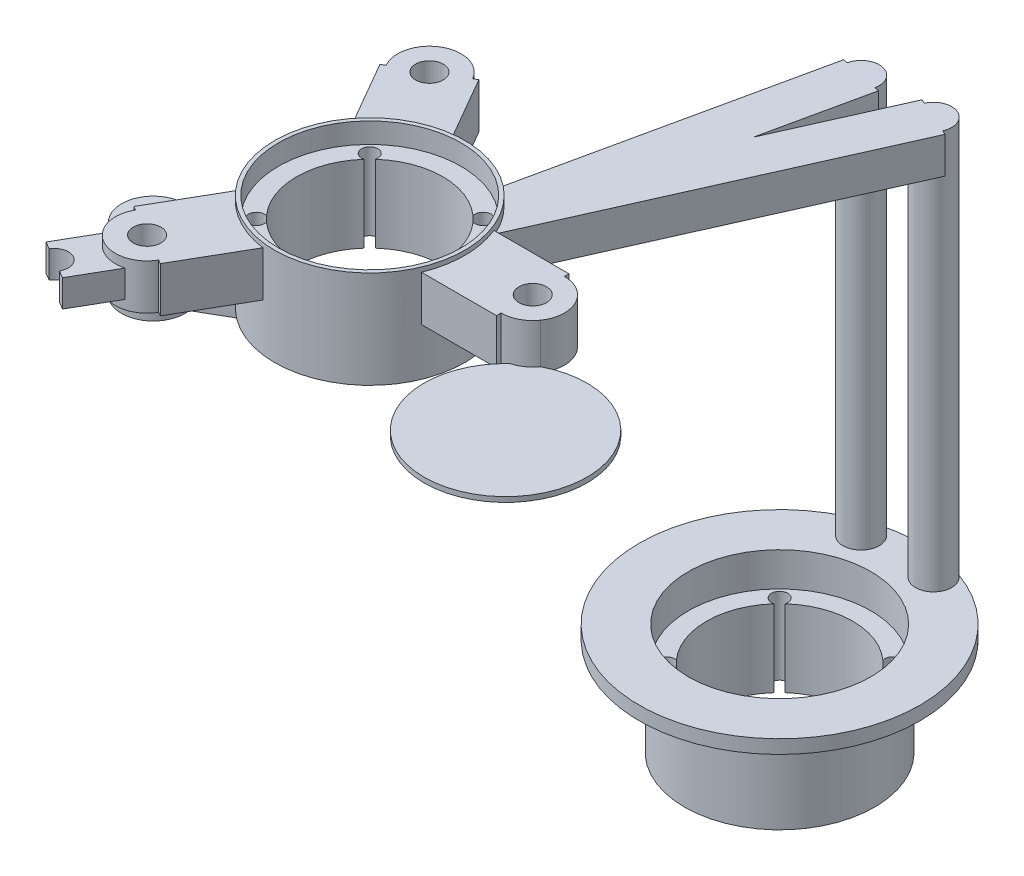
from build123d import *
from build123d.topology import SkipClean

# Parameters (mm, degrees)
CARRIER_GUIDE_FRAME_SKETCH_R   = 3.050000002
CARRIER_GUIDE_FRAME_SKETCH_R_2 = 3.050000001
CARRIER_GUIDE_FRAME_SKETCH_R_3 = 3.049999999
CARRIER_GUIDE_FRAME_DEPTH      = 4.5
CARRIER_START                  = -0.9
CARRIER_SECTION_2_SKETCH_R     = 3.050000002
CARRIER_SECTION_2_SKETCH_R_2   = 3.050000001
CARRIER_SECTION_2_SKETCH_R_3   = 3.049999999
CARRIER_SECTION_2_DEPTH        = 0.9
CARRIER_START_2                = -0.099999999
CARRIER_SECTION_3_SKETCH_R     = 3.050000002
CARRIER_SECTION_3_SKETCH_R_2   = 3.050000001
CARRIER_SECTION_3_SKETCH_R_3   = 3.049999999
CARRIER_SECTION_3_DEPTH        = 0.099999999
CARRIER_START_3                = -0.999999997
CARRIER_SECTION_4_SKETCH_R     = 4
CARRIER_SECTION_4_SKETCH_R_2   = 3.050000002
CARRIER_SECTION_4_SKETCH_R_3   = 3.050000001
CARRIER_SECTION_4_SKETCH_R_4   = 3.049999999
CARRIER_SECTION_4_DEPTH        = 0.999999997
CARRIER_START_4                = -0.010000004
CARRIER_SECTION_5_SKETCH_R     = 21
CARRIER_SECTION_5_SKETCH_R_2   = 18.000000001
CARRIER_SECTION_5_SKETCH_R_3   = 4
CARRIER_SECTION_5_DEPTH        = 0.010000004
CARRIER_START_5                = -0.490000001
CARRIER_SECTION_6_SKETCH_R     = 21
CARRIER_SECTION_6_SKETCH_R_2   = 4
CARRIER_SECTION_6_DEPTH        = 0.490000001
CARRIER_START_6                = -2.999999998
CARRIER_SECTION_7_SKETCH_R     = 21
CARRIER_SECTION_7_SKETCH_R_2   = 4
CARRIER_SECTION_7_SKETCH_R_3   = 3.1
CARRIER_SECTION_7_DEPTH        = 2.999999998
CARRIER_SECTION_8_SKETCH_R     = 21
CARRIER_SECTION_8_SKETCH_R_2   = 4
CARRIER_SECTION_8_DEPTH        = 2.500000001
CARRIER_SECTION_9_SKETCH_R     = 4
CARRIER_SECTION_9_DEPTH        = 4.5
CARRIER_SECTION_10_SKETCH_R    = 4
CARRIER_SECTION_10_DEPTH       = 1.000000001
CARRIER_SECTION_11_SKETCH_R    = 4
CARRIER_SECTION_11_SKETCH_R_2  = 3.1
CARRIER_SECTION_11_DEPTH       = 0.5
CARRIER_SECTION_12_SKETCH_R    = 4
CARRIER_SECTION_12_SKETCH_R_2  = 3.1
CARRIER_SECTION_12_DEPTH       = 2.499999999
CARRIER_SECTION_13_SKETCH_R    = 4
CARRIER_SECTION_13_DEPTH       = 64.500000004
CARRIER_SECTION_14_SKETCH_R    = 20.15
CARRIER_SECTION_14_DEPTH       = 2.999999999
CARRIER_SECTION_15_SKETCH_R    = 21
CARRIER_SECTION_15_SKETCH_R_2  = 20.15
CARRIER_SECTION_15_DEPTH       = 4.499999998
CARRIER_SECTION_16_SKETCH_R    = 21
CARRIER_SECTION_16_DEPTH       = 17
CARRIER_SECTION_17_SKETCH_R    = 3.050000003
CARRIER_SECTION_17_SKETCH_R_2  = 20.150000001
CARRIER_SECTION_17_SKETCH_R_3  = 3.05
CARRIER_SECTION_17_DEPTH       = 1.499999999
CARRIER_SECTION_18_SKETCH_R    = 3.050000003
CARRIER_SECTION_18_SKETCH_R_2  = 20.150000001
CARRIER_SECTION_18_SKETCH_R_3  = 3.05
CARRIER_SECTION_18_DEPTH       = 0.999999998
CARRIER_SECTION_19_SKETCH_R    = 3.050000003
CARRIER_SECTION_19_SKETCH_R_2  = 20.150000001
CARRIER_SECTION_19_SKETCH_R_3  = 3.05
CARRIER_SECTION_19_DEPTH       = 1.000000007
CARRIER_START_7                = -123.999999996
CARRIER_SECTION_20_OUTLINE_R   = 21
CARRIER_SECTION_20_OUTLINE_R_2 = 20.150000001
CARRIER_SECTION_20_DEPTH       = 0.999999996


with BuildPart() as part:
    # Carrier Guide Frame Sketch → Carrier Guide Frame (new body)
    with BuildSketch(Plane(origin=(0, -132, 0), x_dir=(1, 0, 0), z_dir=(0, 1, 0))):
        with BuildLine():
            Line((-67.363448016, 35.176914536), (-59.071691935, 20.815171721))
            ThreePointArc((-59.071691935, 20.815171721), (-52.021603007, 20.561291011), (-45.453402185, 17.987005234))
            Line((-45.453402185, 17.987005234), (-31.894893673, 80.307817537))
            Line((-31.894893673, 80.307817537), (-30.917751514, 80.095230605))
            ThreePointArc((-30.917751514, 80.095230605), (-29.450257235, 82.413661193), (-26.834136801, 83.241050902))
            ThreePointArc((-26.834136801, 83.241050902), (-23.840404569, 81.68595723), (-23.100614252, 78.394535152))
            Line((-23.100614252, 78.394535152), (-22.123472094, 78.181948221))
            Line((-22.123472094, 78.181948221), (-27.059261592, 55.49490926))
            Line((-27.059261592, 55.49490926), (-15.576730603, 81.278969365))
            Line((-15.576730603, 81.278969365), (-14.663221052, 80.872152065))
            ThreePointArc((-14.663221052, 80.872152065), (-12.020207409, 83.115002953), (-8.617920583, 82.451417558))
            ThreePointArc((-8.617920583, 82.451417558), (-7.1390628, 80.255907409), (-7.355144702, 77.617613686))
            Line((-7.355144702, 77.617613686), (-6.441635165, 77.210796392))
            Line((-6.441635165, 77.210796392), (-37.06497245, 8.445994462))
            ThreePointArc((-37.06497245, 8.445994462), (-36.968781126, 8.223544876), (-36.875163407, 8))
            Line((-36.875163407, 8), (-20.291651247, 8))
            Line((-20.291651247, 8), (-20.291651247, 7))
            ThreePointArc((-20.291651247, 7), (-14.084717769, 3.236352392), (-14.552272959, -4.007435199))
            Line((-14.552272959, -4.007435199), (-14.566573894, -4.027839286))
            ThreePointArc((-14.566573894, -4.027839286), (-17.066350873, -6.212683599), (-20.291651246, -7))
            Line((-20.291651246, -7), (-20.291651246, -8))
            Line((-20.291651246, -8), (-36.875163407, -8))
            ThreePointArc((-36.875163407, -8), (-44.6083298, -17.449928367), (-56.291651246, -21))
            ThreePointArc((-56.291651246, -21), (-57.684740236, -20.953741982), (-59.071691937, -20.815171721))
            Line((-59.071691937, -20.815171721), (-67.363448017, -35.176914536))
            Line((-67.363448017, -35.176914536), (-68.229473419, -34.676914537))
            ThreePointArc((-68.229473419, -34.676914537), (-70.002040821, -36.708572734), (-72.411013969, -37.919555224))
            Line((-72.411013969, -37.919555224), (-77.461524226, -46.667295594))
            Line((-77.461524226, -46.667295594), (-79.106972494, -45.717295594))
            ThreePointArc((-79.106972494, -45.717295594), (-80.241651245, -41.482616842), (-84.476329997, -42.617295594))
            Line((-84.476329997, -42.617295594), (-86.121778264, -41.667295594))
            Line((-86.121778264, -41.667295594), (-81.071268007, -32.919555224))
            ThreePointArc((-81.071268007, -32.919555224), (-81.227012981, -30.227832035), (-80.353829072, -27.676914537))
            Line((-80.353829072, -27.676914537), (-81.219854478, -27.176914536))
            Line((-81.219854478, -27.176914536), (-72.928098397, -12.815171719))
            ThreePointArc((-72.928098397, -12.815171719), (-77.291651246, 0), (-72.928098397, 12.815171719))
            Line((-72.928098397, 12.815171719), (-81.219854478, 27.176914536))
            Line((-81.219854478, 27.176914536), (-80.353829074, 27.676914536))
            ThreePointArc((-80.353829074, 27.676914536), (-77.791651248, 37.239092362), (-68.229473421, 34.676914535))
            Line((-68.229473421, 34.676914535), (-67.363448016, 35.176914536))
        make_face()
        with Locations(Location((-74.291651248, 31.176914536, 0), (0, 0, 270))):
            Circle(CARRIER_GUIDE_FRAME_SKETCH_R, mode=Mode.SUBTRACT)
        with Locations(Location((-20.291651247, 0, 0), (0, 0, 270))):
            Circle(CARRIER_GUIDE_FRAME_SKETCH_R_2, mode=Mode.SUBTRACT)
        with Locations(Location((-74.291651245, -31.176914537, 0), (0, 0, 270))):
            Circle(CARRIER_GUIDE_FRAME_SKETCH_R_3, mode=Mode.SUBTRACT)
        with BuildLine():
            ThreePointArc((-68.31259652, -10.785146023), (-70.080233479, -13.788582233), (-67.076797269, -12.020945274))
            ThreePointArc((-67.076797269, -12.020945274), (-56.291651246, -16.15), (-45.506505223, -12.020945274))
            ThreePointArc((-45.506505223, -12.020945274), (-42.503069013, -13.788582233), (-44.270705972, -10.785146023))
            ThreePointArc((-44.270705972, -10.785146023), (-40.141651246, 0), (-44.270705972, 10.785146023))
            ThreePointArc((-44.270705972, 10.785146023), (-42.503069013, 13.788582233), (-45.506505223, 12.020945274))
            ThreePointArc((-45.506505223, 12.020945274), (-56.291651246, 16.15), (-67.076797269, 12.020945274))
            ThreePointArc((-67.076797269, 12.020945274), (-70.080233479, 13.788582233), (-68.31259652, 10.785146023))
            ThreePointArc((-68.31259652, 10.785146023), (-72.441651246, 0), (-68.31259652, -10.785146023))
        make_face(mode=Mode.SUBTRACT)
    extrude(amount=CARRIER_GUIDE_FRAME_DEPTH)

    # Carrier Section 2 Sketch → Carrier Section 2 (add)
    with BuildSketch(Plane(origin=(0, -132, 0), x_dir=(1, 0, 0), z_dir=(0, 1, 0)).offset(CARRIER_START)):
        with BuildLine():
            Line((-67.363448016, 35.176914536), (-59.071691936, 20.815171721))
            ThreePointArc((-59.071691936, 20.815171721), (-52.021603008, 20.561291011), (-45.453402185, 17.987005234))
            Line((-45.453402185, 17.987005234), (-31.894893673, 80.307817537))
            Line((-31.894893673, 80.307817537), (-30.917751514, 80.095230605))
            ThreePointArc((-30.917751514, 80.095230605), (-29.450257235, 82.413661193), (-26.834136801, 83.241050902))
            ThreePointArc((-26.834136801, 83.241050902), (-23.840404569, 81.68595723), (-23.100614253, 78.394535152))
            Line((-23.100614253, 78.394535152), (-22.123472094, 78.181948221))
            Line((-22.123472094, 78.181948221), (-27.059261592, 55.49490926))
            Line((-27.059261592, 55.49490926), (-15.576730603, 81.278969365))
            Line((-15.576730603, 81.278969365), (-14.663221052, 80.872152065))
            ThreePointArc((-14.663221052, 80.872152065), (-12.020207409, 83.115002953), (-8.617920583, 82.451417558))
            ThreePointArc((-8.617920583, 82.451417558), (-7.1390628, 80.255907409), (-7.355144702, 77.617613686))
            Line((-7.355144702, 77.617613686), (-6.441635165, 77.210796392))
            Line((-6.441635165, 77.210796392), (-37.06497245, 8.445994462))
            ThreePointArc((-37.06497245, 8.445994462), (-36.968781126, 8.223544876), (-36.875163407, 8))
            Line((-36.875163407, 8), (-20.291651247, 8))
            Line((-20.291651247, 8), (-20.291651247, 7))
            ThreePointArc((-20.291651247, 7), (-14.084717769, 3.236352392), (-14.55227296, -4.007435199))
            Line((-14.55227296, -4.007435199), (-14.566573895, -4.027839286))
            ThreePointArc((-14.566573895, -4.027839286), (-17.066350873, -6.212683599), (-20.291651246, -7))
            Line((-20.291651246, -7), (-20.291651246, -8))
            Line((-20.291651246, -8), (-36.875163407, -8))
            ThreePointArc((-36.875163407, -8), (-44.6083298, -17.449928367), (-56.291651246, -21))
            ThreePointArc((-56.291651246, -21), (-57.684740236, -20.953741982), (-59.071691937, -20.815171721))
            Line((-59.071691937, -20.815171721), (-67.363448017, -35.176914536))
            Line((-67.363448017, -35.176914536), (-68.229473419, -34.676914537))
            ThreePointArc((-68.229473419, -34.676914537), (-70.002040821, -36.708572734), (-72.411013969, -37.919555224))
            ThreePointArc((-72.411013969, -37.919555224), (-79.823309442, -35.466524962), (-80.353829071, -27.676914537))
            Line((-80.353829071, -27.676914537), (-81.219854478, -27.176914536))
            Line((-81.219854478, -27.176914536), (-72.928098397, -12.815171719))
            ThreePointArc((-72.928098397, -12.815171719), (-77.291651246, 0), (-72.928098397, 12.815171719))
            Line((-72.928098397, 12.815171719), (-81.219854478, 27.176914536))
            Line((-81.219854478, 27.176914536), (-80.353829074, 27.676914536))
            ThreePointArc((-80.353829074, 27.676914536), (-77.791651248, 37.239092362), (-68.229473421, 34.676914535))
            Line((-68.229473421, 34.676914535), (-67.363448016, 35.176914536))
        make_face()
        with Locations(Location((-74.291651248, 31.176914536, 0), (0, 0, 269.999999999))):
            Circle(CARRIER_SECTION_2_SKETCH_R, mode=Mode.SUBTRACT)
        with Locations(Location((-20.291651247, 0, 0), (0, 0, 270.000000005))):
            Circle(CARRIER_SECTION_2_SKETCH_R_2, mode=Mode.SUBTRACT)
        with Locations(Location((-74.291651245, -31.176914537, 0), (0, 0, 270.000000001))):
            Circle(CARRIER_SECTION_2_SKETCH_R_3, mode=Mode.SUBTRACT)
        with BuildLine():
            ThreePointArc((-68.31259652, -10.785146023), (-70.080233479, -13.788582233), (-67.076797269, -12.020945274))
            ThreePointArc((-67.076797269, -12.020945274), (-56.291651246, -16.15), (-45.506505223, -12.020945274))
            ThreePointArc((-45.506505223, -12.020945274), (-42.503069013, -13.788582233), (-44.270705972, -10.785146023))
            ThreePointArc((-44.270705972, -10.785146023), (-40.141651246, 0), (-44.270705972, 10.785146023))
            ThreePointArc((-44.270705972, 10.785146023), (-42.503069013, 13.788582233), (-45.506505223, 12.020945274))
            ThreePointArc((-45.506505223, 12.020945274), (-56.291651246, 16.15), (-67.076797269, 12.020945274))
            ThreePointArc((-67.076797269, 12.020945274), (-70.080233479, 13.788582233), (-68.31259652, 10.785146023))
            ThreePointArc((-68.31259652, 10.785146023), (-72.441651246, 0), (-68.31259652, -10.785146023))
        make_face(mode=Mode.SUBTRACT)
    extrude(amount=CARRIER_SECTION_2_DEPTH)

    # Carrier Section 3 Sketch → Carrier Section 3 (add)
    with BuildSketch(Plane(origin=(0, -132.900000001, 0), x_dir=(1, 0, 0), z_dir=(0, 1, 0)).offset(CARRIER_START_2)):
        with BuildLine():
            Line((-67.363448016, 35.176914536), (-59.071691936, 20.815171721))
            ThreePointArc((-59.071691936, 20.815171721), (-52.021603008, 20.561291011), (-45.453402185, 17.987005234))
            Line((-45.453402185, 17.987005234), (-31.894893673, 80.307817537))
            Line((-31.894893673, 80.307817537), (-30.917751514, 80.095230605))
            ThreePointArc((-30.917751514, 80.095230605), (-29.450257235, 82.413661193), (-26.834136801, 83.241050902))
            ThreePointArc((-26.834136801, 83.241050902), (-23.840404569, 81.68595723), (-23.100614253, 78.394535152))
            Line((-23.100614253, 78.394535152), (-22.123472094, 78.181948221))
            Line((-22.123472094, 78.181948221), (-27.059261593, 55.49490926))
            Line((-27.059261593, 55.49490926), (-15.576730603, 81.278969365))
            Line((-15.576730603, 81.278969365), (-14.663221052, 80.872152065))
            ThreePointArc((-14.663221052, 80.872152065), (-12.020207409, 83.115002953), (-8.617920583, 82.451417558))
            ThreePointArc((-8.617920583, 82.451417558), (-7.1390628, 80.255907409), (-7.355144702, 77.617613686))
            Line((-7.355144702, 77.617613686), (-6.441635165, 77.210796392))
            Line((-6.441635165, 77.210796392), (-37.06497245, 8.445994462))
            ThreePointArc((-37.06497245, 8.445994462), (-36.968781126, 8.223544876), (-36.875163407, 8))
            Line((-36.875163407, 8), (-20.291651247, 8))
            Line((-20.291651247, 8), (-20.291651247, 7))
            ThreePointArc((-20.291651247, 7), (-14.084717769, 3.236352392), (-14.55227296, -4.007435199))
            ThreePointArc((-14.55227296, -4.007435199), (4.030670954, -34.74617457), (-18.490761077, -6.764376882))
            ThreePointArc((-18.490761077, -6.764376882), (-19.383531808, -6.940844263), (-20.291651246, -7))
            Line((-20.291651246, -7), (-20.291651246, -8))
            Line((-20.291651246, -8), (-36.875163407, -8))
            ThreePointArc((-36.875163407, -8), (-44.6083298, -17.449928367), (-56.291651246, -21))
            ThreePointArc((-56.291651246, -21), (-57.684740236, -20.953741982), (-59.071691937, -20.815171721))
            Line((-59.071691937, -20.815171721), (-67.363448017, -35.176914536))
            Line((-67.363448017, -35.176914536), (-68.229473419, -34.676914537))
            ThreePointArc((-68.229473419, -34.676914537), (-70.002040821, -36.708572734), (-72.411013969, -37.919555224))
            ThreePointArc((-72.411013969, -37.919555224), (-79.823309442, -35.466524962), (-80.353829071, -27.676914537))
            Line((-80.353829071, -27.676914537), (-81.219854478, -27.176914536))
            Line((-81.219854478, -27.176914536), (-72.928098397, -12.815171719))
            ThreePointArc((-72.928098397, -12.815171719), (-77.291651246, 0), (-72.928098397, 12.815171719))
            Line((-72.928098397, 12.815171719), (-81.219854478, 27.176914536))
            Line((-81.219854478, 27.176914536), (-80.353829074, 27.676914536))
            ThreePointArc((-80.353829074, 27.676914536), (-77.791651248, 37.239092362), (-68.229473421, 34.676914535))
            Line((-68.229473421, 34.676914535), (-67.363448016, 35.176914536))
        make_face()
        with Locations(Location((-74.291651248, 31.176914536, 0), (0, 0, 269.999999999))):
            Circle(CARRIER_SECTION_3_SKETCH_R, mode=Mode.SUBTRACT)
        with Locations(Location((-20.291651247, 0, 0), (0, 0, 270.000000006))):
            Circle(CARRIER_SECTION_3_SKETCH_R_2, mode=Mode.SUBTRACT)
        with Locations(Location((-74.291651245, -31.176914537, 0), (0, 0, 270.000000001))):
            Circle(CARRIER_SECTION_3_SKETCH_R_3, mode=Mode.SUBTRACT)
        with BuildLine():
            ThreePointArc((-68.31259652, -10.785146023), (-70.080233479, -13.788582233), (-67.076797269, -12.020945274))
            ThreePointArc((-67.076797269, -12.020945274), (-56.291651246, -16.15), (-45.506505223, -12.020945274))
            ThreePointArc((-45.506505223, -12.020945274), (-42.503069013, -13.788582233), (-44.270705972, -10.785146023))
            ThreePointArc((-44.270705972, -10.785146023), (-40.141651246, 0), (-44.270705972, 10.785146023))
            ThreePointArc((-44.270705972, 10.785146023), (-42.503069013, 13.788582233), (-45.506505223, 12.020945274))
            ThreePointArc((-45.506505223, 12.020945274), (-56.291651246, 16.15), (-67.076797269, 12.020945274))
            ThreePointArc((-67.076797269, 12.020945274), (-70.080233479, 13.788582233), (-68.31259652, 10.785146023))
            ThreePointArc((-68.31259652, 10.785146023), (-72.441651246, 0), (-68.31259652, -10.785146023))
        make_face(mode=Mode.SUBTRACT)
    extrude(amount=CARRIER_SECTION_3_DEPTH)

    # Carrier Section 4 Sketch → Carrier Section 4 (add)
    # profile 1 of 3: a face of its own
    with BuildSketch(Plane(origin=(0, -133, 0), x_dir=(1, 0, 0), z_dir=(0, 1, 0)).offset(CARRIER_START_3)):
        with Locations(Location((-27.009182884, 79.244882879, 0), (0, 0, 167.726003725))):
            Circle(CARRIER_SECTION_4_SKETCH_R)
    # profile 2 of 3: a face of its own
    with BuildSketch(Plane(origin=(0, -133, 0), x_dir=(1, 0, 0), z_dir=(0, 1, 0)).offset(CARRIER_START_3)):
        with Locations(Location((-11.009182876, 79.244882879, 0), (0, 0, 155.994941476))):
            Circle(CARRIER_SECTION_4_SKETCH_R)
    # profile 3 of 3: a face of its own
    with BuildSketch(Plane(origin=(0, -133, 0), x_dir=(1, 0, 0), z_dir=(0, 1, 0)).offset(CARRIER_START_3)):
        with BuildLine():
            Line((-67.363448016, 35.176914536), (-59.071691936, 20.815171721))
            ThreePointArc((-59.071691936, 20.815171721), (-45.791651246, 18.18653348), (-36.875163407, 8))
            Line((-36.875163407, 8), (-20.291651247, 8))
            Line((-20.291651247, 8), (-20.291651247, 7))
            ThreePointArc((-20.291651247, 7), (-14.084717769, 3.236352392), (-14.55227296, -4.007435199))
            ThreePointArc((-14.55227296, -4.007435199), (4.030670954, -34.74617457), (-18.490761077, -6.764376882))
            ThreePointArc((-18.490761077, -6.764376882), (-19.383531808, -6.940844263), (-20.291651246, -7))
            Line((-20.291651246, -7), (-20.291651246, -8))
            Line((-20.291651246, -8), (-36.875163407, -8))
            ThreePointArc((-36.875163407, -8), (-44.6083298, -17.449928367), (-56.291651246, -21))
            ThreePointArc((-56.291651246, -21), (-57.684740236, -20.953741982), (-59.071691937, -20.815171721))
            Line((-59.071691937, -20.815171721), (-67.363448017, -35.176914536))
            Line((-67.363448017, -35.176914536), (-68.229473419, -34.676914537))
            ThreePointArc((-68.229473419, -34.676914537), (-70.002040821, -36.708572734), (-72.411013969, -37.919555224))
            ThreePointArc((-72.411013969, -37.919555224), (-79.823309442, -35.466524962), (-80.353829071, -27.676914537))
            Line((-80.353829071, -27.676914537), (-81.219854478, -27.176914536))
            Line((-81.219854478, -27.176914536), (-72.928098397, -12.815171719))
            ThreePointArc((-72.928098397, -12.815171719), (-77.291651246, 0), (-72.928098397, 12.815171719))
            Line((-72.928098397, 12.815171719), (-81.219854478, 27.176914536))
            Line((-81.219854478, 27.176914536), (-80.353829074, 27.676914536))
            ThreePointArc((-80.353829074, 27.676914536), (-77.791651248, 37.239092362), (-68.229473421, 34.676914535))
            Line((-68.229473421, 34.676914535), (-67.363448016, 35.176914536))
        make_face()
        with Locations(Location((-74.291651248, 31.176914536, 0), (0, 0, 269.999999999))):
            Circle(CARRIER_SECTION_4_SKETCH_R_2, mode=Mode.SUBTRACT)
        with Locations(Location((-20.291651247, 0, 0), (0, 0, 270.000000006))):
            Circle(CARRIER_SECTION_4_SKETCH_R_3, mode=Mode.SUBTRACT)
        with Locations(Location((-74.291651245, -31.176914537, 0), (0, 0, 270.000000001))):
            Circle(CARRIER_SECTION_4_SKETCH_R_4, mode=Mode.SUBTRACT)
        with BuildLine():
            ThreePointArc((-68.31259652, -10.785146023), (-70.080233479, -13.788582233), (-67.076797269, -12.020945274))
            ThreePointArc((-67.076797269, -12.020945274), (-56.291651246, -16.15), (-45.506505223, -12.020945274))
            ThreePointArc((-45.506505223, -12.020945274), (-42.503069013, -13.788582233), (-44.270705972, -10.785146023))
            ThreePointArc((-44.270705972, -10.785146023), (-40.141651246, 0), (-44.270705972, 10.785146023))
            ThreePointArc((-44.270705972, 10.785146023), (-42.503069013, 13.788582233), (-45.506505223, 12.020945274))
            ThreePointArc((-45.506505223, 12.020945274), (-56.291651246, 16.15), (-67.076797269, 12.020945274))
            ThreePointArc((-67.076797269, 12.020945274), (-70.080233479, 13.788582233), (-68.31259652, 10.785146023))
            ThreePointArc((-68.31259652, 10.785146023), (-72.441651246, 0), (-68.31259652, -10.785146023))
        make_face(mode=Mode.SUBTRACT)
    extrude(amount=CARRIER_SECTION_4_DEPTH)

    # Carrier Section 5 Sketch → Carrier Section 5 (add)
    # profile 1 of 4: a face of its own
    with SkipClean():  # the faces are left unmerged after this step: merging them gives an invalid solid
        with BuildSketch(Plane(origin=(0, -133.999999997, 0), x_dir=(1, 0, 0), z_dir=(0, 1, 0)).offset(CARRIER_START_4)):
            with Locations(Location((-56.291651246, 0, 0), (0, 0, 97.607312195))):
                Circle(CARRIER_SECTION_5_SKETCH_R)
            with BuildLine():
                ThreePointArc((-68.31259652, -10.785146023), (-70.080233479, -13.788582233), (-67.076797269, -12.020945274))
                ThreePointArc((-67.076797269, -12.020945274), (-56.291651246, -16.15), (-45.506505223, -12.020945274))
                ThreePointArc((-45.506505223, -12.020945274), (-42.503069013, -13.788582233), (-44.270705972, -10.785146023))
                ThreePointArc((-44.270705972, -10.785146023), (-40.141651246, 0), (-44.270705972, 10.785146023))
                ThreePointArc((-44.270705972, 10.785146023), (-42.503069013, 13.788582233), (-45.506505223, 12.020945274))
                ThreePointArc((-45.506505223, 12.020945274), (-56.291651246, 16.15), (-67.076797269, 12.020945274))
                ThreePointArc((-67.076797269, 12.020945274), (-70.080233479, 13.788582233), (-68.31259652, 10.785146023))
                ThreePointArc((-68.31259652, 10.785146023), (-72.441651246, 0), (-68.31259652, -10.785146023))
            make_face(mode=Mode.SUBTRACT)
        # profile 2 of 4: a face of its own
        with BuildSketch(Plane(origin=(0, -133.999999997, 0), x_dir=(1, 0, 0), z_dir=(0, 1, 0)).offset(CARRIER_START_4)):
            with Locations(Location((-6.291651246, -20, 0), (0, 0, 270))):
                Circle(CARRIER_SECTION_5_SKETCH_R_2)
        # profile 3 of 4: a face of its own
        with BuildSketch(Plane(origin=(0, -133.999999997, 0), x_dir=(1, 0, 0), z_dir=(0, 1, 0)).offset(CARRIER_START_4)):
            with Locations(Location((-27.009182884, 79.244882879, 0), (0, 0, 167.726003725))):
                Circle(CARRIER_SECTION_5_SKETCH_R_3)
        # profile 4 of 4: a face of its own
        with BuildSketch(Plane(origin=(0, -133.999999997, 0), x_dir=(1, 0, 0), z_dir=(0, 1, 0)).offset(CARRIER_START_4)):
            with Locations(Location((-11.009182876, 79.244882879, 0), (0, 0, 155.994941476))):
                Circle(CARRIER_SECTION_5_SKETCH_R_3)
        extrude(amount=CARRIER_SECTION_5_DEPTH)

    # Carrier Section 6 Sketch → Carrier Section 6 (add)
    # profile 1 of 3: a face of its own
    with SkipClean():  # the faces are left unmerged after this step: merging them gives an invalid solid
        with BuildSketch(Plane(origin=(0, -134.010000001, 0), x_dir=(1, 0, 0), z_dir=(0, 1, 0)).offset(CARRIER_START_5)):
            with Locations(Location((-56.291651246, 0, 0), (0, 0, 97.607312195))):
                Circle(CARRIER_SECTION_6_SKETCH_R)
            with BuildLine():
                ThreePointArc((-68.31259652, -10.785146023), (-70.080233479, -13.788582233), (-67.076797269, -12.020945274))
                ThreePointArc((-67.076797269, -12.020945274), (-56.291651246, -16.15), (-45.506505223, -12.020945274))
                ThreePointArc((-45.506505223, -12.020945274), (-42.503069013, -13.788582233), (-44.270705972, -10.785146023))
                ThreePointArc((-44.270705972, -10.785146023), (-40.141651246, 0), (-44.270705972, 10.785146023))
                ThreePointArc((-44.270705972, 10.785146023), (-42.503069013, 13.788582233), (-45.506505223, 12.020945274))
                ThreePointArc((-45.506505223, 12.020945274), (-56.291651246, 16.15), (-67.076797269, 12.020945274))
                ThreePointArc((-67.076797269, 12.020945274), (-70.080233479, 13.788582233), (-68.31259652, 10.785146023))
                ThreePointArc((-68.31259652, 10.785146023), (-72.441651246, 0), (-68.31259652, -10.785146023))
            make_face(mode=Mode.SUBTRACT)
        # profile 2 of 3: a face of its own
        with BuildSketch(Plane(origin=(0, -134.010000001, 0), x_dir=(1, 0, 0), z_dir=(0, 1, 0)).offset(CARRIER_START_5)):
            with Locations(Location((-27.009182884, 79.244882879, 0), (0, 0, 167.726003725))):
                Circle(CARRIER_SECTION_6_SKETCH_R_2)
        # profile 3 of 3: a face of its own
        with BuildSketch(Plane(origin=(0, -134.010000001, 0), x_dir=(1, 0, 0), z_dir=(0, 1, 0)).offset(CARRIER_START_5)):
            with Locations(Location((-11.009182876, 79.244882879, 0), (0, 0, 155.994941476))):
                Circle(CARRIER_SECTION_6_SKETCH_R_2)
        extrude(amount=CARRIER_SECTION_6_DEPTH)

    # Carrier Section 7 Sketch → Carrier Section 7 (add)
    # profile 1 of 4: a face of its own
    with SkipClean():  # the faces are left unmerged after this step: merging them gives an invalid solid
        with BuildSketch(Plane(origin=(0, -134.500000002, 0), x_dir=(1, 0, 0), z_dir=(0, 1, 0)).offset(CARRIER_START_6)):
            with Locations(Location((-56.291651246, 0, 0), (0, 0, 97.607312195))):
                Circle(CARRIER_SECTION_7_SKETCH_R)
            with BuildLine():
                ThreePointArc((-68.31259652, -10.785146023), (-70.080233479, -13.788582233), (-67.076797269, -12.020945274))
                ThreePointArc((-67.076797269, -12.020945274), (-56.291651246, -16.15), (-45.506505223, -12.020945274))
                ThreePointArc((-45.506505223, -12.020945274), (-42.503069013, -13.788582233), (-44.270705972, -10.785146023))
                ThreePointArc((-44.270705972, -10.785146023), (-40.141651246, 0), (-44.270705972, 10.785146023))
                ThreePointArc((-44.270705972, 10.785146023), (-42.503069013, 13.788582233), (-45.506505223, 12.020945274))
                ThreePointArc((-45.506505223, 12.020945274), (-56.291651246, 16.15), (-67.076797269, 12.020945274))
                ThreePointArc((-67.076797269, 12.020945274), (-70.080233479, 13.788582233), (-68.31259652, 10.785146023))
                ThreePointArc((-68.31259652, 10.785146023), (-72.441651246, 0), (-68.31259652, -10.785146023))
            make_face(mode=Mode.SUBTRACT)
        # profile 2 of 4: a face of its own
        with BuildSketch(Plane(origin=(0, -134.500000002, 0), x_dir=(1, 0, 0), z_dir=(0, 1, 0)).offset(CARRIER_START_6)):
            with Locations(Location((-27.009182884, 79.244882879, 0), (0, 0, 167.726003725))):
                Circle(CARRIER_SECTION_7_SKETCH_R_2)
        # profile 3 of 4: a face of its own
        with BuildSketch(Plane(origin=(0, -134.500000002, 0), x_dir=(1, 0, 0), z_dir=(0, 1, 0)).offset(CARRIER_START_6)):
            with Locations(Location((-11.009182876, 79.244882879, 0), (0, 0, 155.994941475))):
                Circle(CARRIER_SECTION_7_SKETCH_R_2)
        # profile 4 of 4: a face of its own
        with BuildSketch(Plane(origin=(0, -134.500000002, 0), x_dir=(1, 0, 0), z_dir=(0, 1, 0)).offset(CARRIER_START_6)):
            with BuildLine():
                ThreePointArc((-80.877463026, -21.527839286), (-92.534816728, -13.784075176), (-80.480041275, -20.893376598))
                ThreePointArc((-80.480041275, -20.893376598), (-80.670264028, -21.215924826), (-80.877463026, -21.527839286))
            make_face()
            with Locations(Location((-86.602540378, -17.500000001, 0), (0, 0, 270))):
                Circle(CARRIER_SECTION_7_SKETCH_R_3, mode=Mode.SUBTRACT)
        extrude(amount=CARRIER_SECTION_7_DEPTH)


with BuildPart() as carrier_section_7_piece_1:
    # of the separate pieces the step leaves, piece 1, a body of its own (carrier_section_7_pieces)
    add(part.part.solids().sort_by_distance((-68.229473421, -132, -34.676914535))[0])

    # Carrier Section 8 Sketch → Carrier Section 8 (add)
    # profile 1 of 4: a face of its own
    with SkipClean():  # the faces are left unmerged after this step: merging them gives an invalid solid
        with BuildSketch(Plane(origin=(0, -137.5, 0), x_dir=(1, 0, 0), z_dir=(0, 1, 0))):
            with Locations(Location((-56.291651246, 0, 0), (0, 0, 97.607312195))):
                Circle(CARRIER_SECTION_8_SKETCH_R)
            with BuildLine():
                ThreePointArc((-68.31259652, -10.785146023), (-70.080233479, -13.788582233), (-67.076797269, -12.020945274))
                ThreePointArc((-67.076797269, -12.020945274), (-56.291651246, -16.15), (-45.506505223, -12.020945274))
                ThreePointArc((-45.506505223, -12.020945274), (-42.503069013, -13.788582233), (-44.270705972, -10.785146023))
                ThreePointArc((-44.270705972, -10.785146023), (-40.141651246, 0), (-44.270705972, 10.785146023))
                ThreePointArc((-44.270705972, 10.785146023), (-42.503069013, 13.788582233), (-45.506505223, 12.020945274))
                ThreePointArc((-45.506505223, 12.020945274), (-56.291651246, 16.15), (-67.076797269, 12.020945274))
                ThreePointArc((-67.076797269, 12.020945274), (-70.080233479, 13.788582233), (-68.31259652, 10.785146023))
                ThreePointArc((-68.31259652, 10.785146023), (-72.441651246, 0), (-68.31259652, -10.785146023))
            make_face(mode=Mode.SUBTRACT)
        # profile 2 of 4: a face of its own
        with BuildSketch(Plane(origin=(0, -137.5, 0), x_dir=(1, 0, 0), z_dir=(0, 1, 0))):
            with Locations(Location((-27.009182884, 79.244882879, 0), (0, 0, 167.726003724))):
                Circle(CARRIER_SECTION_8_SKETCH_R_2)
        # profile 3 of 4: a face of its own
        with BuildSketch(Plane(origin=(0, -137.5, 0), x_dir=(1, 0, 0), z_dir=(0, 1, 0))):
            with Locations(Location((-11.009182876, 79.244882879, 0), (0, 0, 155.994941473))):
                Circle(CARRIER_SECTION_8_SKETCH_R_2)
        # profile 4 of 4: a face of its own
        with BuildSketch(Plane(origin=(0, -137.5, 0), x_dir=(1, 0, 0), z_dir=(0, 1, 0))):
            with BuildLine():
                Line((-79.855563295, -19.365020168), (-81.398299852, -18.191650588))
                ThreePointArc((-81.398299852, -18.191650588), (-89.103213885, -12.883818462), (-88.86596326, -22.237026162))
                Line((-88.86596326, -22.237026162), (-88.725821636, -24.170208145))
                ThreePointArc((-88.725821636, -24.170208145), (-89.936771721, -11.345091282), (-79.855563295, -19.365020168))
            make_face()
        extrude(amount=-CARRIER_SECTION_8_DEPTH)


with BuildPart() as carrier_section_7_piece_2:
    # of the separate pieces the step leaves, piece 2, a body of its own (carrier_section_7_pieces)
    add(part.part.solids().sort_by_distance((-80.480041275, -137.5, 20.893376598))[0])


with BuildPart() as carrier_section_8_piece_1:
    # of the separate pieces the step leaves, piece 1, a body of its own (carrier_section_8_pieces)
    add(carrier_section_7_piece_1.part.solids().sort_by_distance((-68.229473421, -132, -34.676914535))[0])

    # Carrier Section 9 Sketch → Carrier Section 9 (add)
    # profile 1 of 3: a face of its own
    with SkipClean():  # the faces are left unmerged after this step: merging them gives an invalid solid
        with BuildSketch(Plane(origin=(0, -140, 0), x_dir=(1, 0, 0), z_dir=(0, 1, 0))):
            with Locations(Location((-27.009182885, 79.244882879, 0), (0, 0, 167.726003723))):
                Circle(CARRIER_SECTION_9_SKETCH_R)
        # profile 2 of 3: a face of its own
        with BuildSketch(Plane(origin=(0, -140, 0), x_dir=(1, 0, 0), z_dir=(0, 1, 0))):
            with Locations(Location((-11.009182877, 79.244882879, 0), (0, 0, 155.994941471))):
                Circle(CARRIER_SECTION_9_SKETCH_R)
        # profile 3 of 3: a face of its own
        with BuildSketch(Plane(origin=(0, -140, 0), x_dir=(1, 0, 0), z_dir=(0, 1, 0))):
            with BuildLine():
                Line((-86.480041404, -10.501071941), (-76.720076308, -4.866153466))
                ThreePointArc((-76.720076308, -4.866153466), (-43.276068719, 16.480127776), (-56.291651249, -20.999999997))
                ThreePointArc((-56.291651249, -20.999999997), (-64.056069295, -19.511888999), (-70.720076304, -15.258458321))
                Line((-70.720076304, -15.258458321), (-78.982709995, -20.028892107))
                Line((-78.982709995, -20.028892107), (-81.398299852, -18.191650588))
                ThreePointArc((-81.398299852, -18.191650588), (-89.103213886, -12.883818462), (-88.86596326, -22.237026162))
                Line((-88.86596326, -22.237026162), (-88.725821637, -24.170208145))
                ThreePointArc((-88.725821637, -24.170208145), (-93.509935226, -16.365144764), (-86.480041404, -10.501071941))
            make_face()
            with BuildLine():
                ThreePointArc((-68.312596522, -10.78514602), (-70.080233482, -13.78858223), (-67.076797271, -12.020945271))
                ThreePointArc((-67.076797271, -12.020945271), (-56.291651249, -16.149999997), (-45.506505226, -12.020945271))
                ThreePointArc((-45.506505226, -12.020945271), (-42.503069016, -13.78858223), (-44.270705975, -10.78514602))
                ThreePointArc((-44.270705975, -10.78514602), (-40.141651249, 3e-09), (-44.270705975, 10.785146025))
                ThreePointArc((-44.270705975, 10.785146025), (-42.503069016, 13.788582236), (-45.506505226, 12.020945276))
                ThreePointArc((-45.506505226, 12.020945276), (-56.291651249, 16.150000003), (-67.076797271, 12.020945276))
                ThreePointArc((-67.076797271, 12.020945276), (-70.080233482, 13.788582236), (-68.312596522, 10.785146025))
                ThreePointArc((-68.312596522, 10.785146025), (-72.441651249, 3e-09), (-68.312596522, -10.78514602))
            make_face(mode=Mode.SUBTRACT)
        extrude(amount=-CARRIER_SECTION_9_DEPTH)

    # Carrier Section 10 Sketch → Carrier Section 10 (add)
    with SkipClean():  # the faces are left unmerged after this step: merging them gives an invalid solid
        with BuildSketch(Plane(origin=(0, -144.5, 0), x_dir=(1, 0, 0), z_dir=(0, 1, 0))):
            with Locations(Location((-27.009182885, 79.244882879, 0), (0, 0, 167.726003722))):
                Circle(CARRIER_SECTION_10_SKETCH_R)
            with Locations(Location((-11.009182877, 79.244882879, 0), (0, 0, 155.994941469))):
                Circle(CARRIER_SECTION_10_SKETCH_R)
            with BuildLine():
                Line((-70.086516533, -14.892672416), (-78.982709996, -20.028892107))
                Line((-78.982709996, -20.028892107), (-81.398299852, -18.191650588))
                ThreePointArc((-81.398299852, -18.191650588), (-89.103213886, -12.883818462), (-88.86596326, -22.237026162))
                Line((-88.86596326, -22.237026162), (-88.725821637, -24.170208145))
                ThreePointArc((-88.725821637, -24.170208145), (-93.509935226, -16.365144764), (-86.480041404, -10.501071941))
                Line((-86.480041404, -10.501071941), (-76.086516537, -4.500367561))
                ThreePointArc((-76.086516537, -4.500367561), (-73.871966947, -10.149999995), (-70.086516533, -14.892672416))
            make_face()
        extrude(amount=-CARRIER_SECTION_10_DEPTH)

    # Carrier Section 11 Sketch → Carrier Section 11 (add)
    # profile 1 of 3: a face of its own
    with SkipClean():  # the faces are left unmerged after this step: merging them gives an invalid solid
        with BuildSketch(Plane(origin=(0, -145.500000001, 0), x_dir=(1, 0, 0), z_dir=(0, 1, 0))):
            with Locations(Location((-27.009182885, 79.244882879, 0), (0, 0, 167.726003722))):
                Circle(CARRIER_SECTION_11_SKETCH_R)
        # profile 2 of 3: a face of its own
        with BuildSketch(Plane(origin=(0, -145.500000001, 0), x_dir=(1, 0, 0), z_dir=(0, 1, 0))):
            with Locations(Location((-11.009182877, 79.244882879, 0), (0, 0, 155.994941469))):
                Circle(CARRIER_SECTION_11_SKETCH_R)
        # profile 3 of 3: a face of its own
        with BuildSketch(Plane(origin=(0, -145.500000001, 0), x_dir=(1, 0, 0), z_dir=(0, 1, 0))):
            with BuildLine():
                Line((-70.086516533, -14.892672417), (-80.480041379, -20.893376784))
                ThreePointArc((-80.480041379, -20.893376784), (-80.670264085, -21.215924916), (-80.877463026, -21.527839286))
                ThreePointArc((-80.877463026, -21.527839286), (-92.843208353, -20.670814289), (-86.480041403, -10.501071941))
                Line((-86.480041403, -10.501071941), (-76.086516538, -4.500367562))
                ThreePointArc((-76.086516538, -4.500367562), (-73.871966947, -10.149999996), (-70.086516533, -14.892672417))
            make_face()
            with Locations(Location((-86.602540379, -17.500000001, 0), (0, 0, 270.000000016))):
                Circle(CARRIER_SECTION_11_SKETCH_R_2, mode=Mode.SUBTRACT)
        extrude(amount=-CARRIER_SECTION_11_DEPTH)

    # Carrier Section 12 Sketch → Carrier Section 12 (add)
    # profile 1 of 3: a face of its own
    with SkipClean():  # the faces are left unmerged after this step: merging them gives an invalid solid
        with BuildSketch(Plane(origin=(0, -146.000000001, 0), x_dir=(1, 0, 0), z_dir=(0, 1, 0))):
            with Locations(Location((-27.009182885, 79.244882879, 0), (0, 0, 167.726003721))):
                Circle(CARRIER_SECTION_12_SKETCH_R)
        # profile 2 of 3: a face of its own
        with BuildSketch(Plane(origin=(0, -146.000000001, 0), x_dir=(1, 0, 0), z_dir=(0, 1, 0))):
            with Locations(Location((-11.009182877, 79.244882879, 0), (0, 0, 155.994941468))):
                Circle(CARRIER_SECTION_12_SKETCH_R)
        # profile 3 of 3: a face of its own
        with BuildSketch(Plane(origin=(0, -146.000000001, 0), x_dir=(1, 0, 0), z_dir=(0, 1, 0))):
            with BuildLine():
                ThreePointArc((-80.480041276, -20.893376598), (-80.670264029, -21.215924826), (-80.877463027, -21.527839286))
                ThreePointArc((-80.877463027, -21.527839286), (-92.534816729, -13.784075177), (-80.480041276, -20.893376598))
            make_face()
            with Locations(Location((-86.602540379, -17.500000001, 0), (0, 0, 270.000000019))):
                Circle(CARRIER_SECTION_12_SKETCH_R_2, mode=Mode.SUBTRACT)
        extrude(amount=-CARRIER_SECTION_12_DEPTH)

    # Carrier Section 13 Sketch → Carrier Section 13 (add)
    with SkipClean():  # the faces are left unmerged after this step: merging them gives an invalid solid
        with BuildSketch(Plane(origin=(0, -148.5, 0), x_dir=(1, 0, 0), z_dir=(0, 1, 0))):
            with Locations(Location((-27.009182888, 79.244882879, 0), (0, 0, 167.726003711))):
                Circle(CARRIER_SECTION_13_SKETCH_R)
            with Locations(Location((-11.00918288, 79.244882879, 0), (0, 0, 155.994941449))):
                Circle(CARRIER_SECTION_13_SKETCH_R)
        extrude(amount=-CARRIER_SECTION_13_DEPTH)

    # Carrier Section 14 Sketch → Carrier Section 14 (add)
    with SkipClean():  # the faces are left unmerged after this step: merging them gives an invalid solid
        with BuildSketch(Plane(origin=(0, -213.000000003, 0), x_dir=(1, 0, 0), z_dir=(0, 1, 0))):
            with BuildLine():
                ThreePointArc((-29.40044519, 82.451417553), (-28.185526288, 83.067998913), (-26.834136809, 83.241050902))
                ThreePointArc((-26.834136809, 83.241050902), (-19.009182884, 84.244882879), (-11.18422896, 83.241050903))
                ThreePointArc((-11.18422896, 83.241050903), (-9.832839488, 83.067998914), (-8.617920591, 82.451417558))
                ThreePointArc((-8.617920591, 82.451417558), (-19.009182875, 22.244882878), (-29.40044519, 82.451417553))
            make_face()
            with Locations(Location((-19.009182883, 53.244882878, 0), (0, 0, 270))):
                Circle(CARRIER_SECTION_14_SKETCH_R, mode=Mode.SUBTRACT)
        extrude(amount=-CARRIER_SECTION_14_DEPTH)

    # Carrier Section 15 Sketch → Carrier Section 15 (add)
    with SkipClean():  # the faces are left unmerged after this step: merging them gives an invalid solid
        with BuildSketch(Plane(origin=(0, -216.000000002, 0), x_dir=(1, 0, 0), z_dir=(0, 1, 0))):
            with Locations(Location((-19.009182883, 53.244882879, 0), (0, 0, 270))):
                Circle(CARRIER_SECTION_15_SKETCH_R)
            with Locations(Location((-19.009182883, 53.244882879, 0), (0, 0, 270.000000001))):
                Circle(CARRIER_SECTION_15_SKETCH_R_2, mode=Mode.SUBTRACT)
        extrude(amount=-CARRIER_SECTION_15_DEPTH)

    # Carrier Section 16 Sketch → Carrier Section 16 (add)
    with SkipClean():  # the faces are left unmerged after this step: merging them gives an invalid solid
        with BuildSketch(Plane(origin=(0, -220.5, 0), x_dir=(1, 0, 0), z_dir=(0, 1, 0))):
            with Locations(Location((-19.009182883, 53.244882879, 0), (0, 0, 270))):
                Circle(CARRIER_SECTION_16_SKETCH_R)
            with BuildLine():
                ThreePointArc((-29.794328906, 65.265828152), (-32.797765116, 67.033465112), (-31.030128157, 64.030028901))
                ThreePointArc((-31.030128157, 64.030028901), (-35.159182883, 53.244882879), (-31.030128157, 42.459736856))
                ThreePointArc((-31.030128157, 42.459736856), (-32.797765116, 39.456300646), (-29.794328906, 41.223937605))
                ThreePointArc((-29.794328906, 41.223937605), (-19.009182883, 37.094882879), (-8.224036861, 41.223937605))
                ThreePointArc((-8.224036861, 41.223937605), (-5.22060065, 39.456300646), (-6.98823761, 42.459736856))
                ThreePointArc((-6.98823761, 42.459736856), (-2.859182883, 53.244882879), (-6.98823761, 64.030028901))
                ThreePointArc((-6.98823761, 64.030028901), (-5.22060065, 67.033465112), (-8.224036861, 65.265828152))
                ThreePointArc((-8.224036861, 65.265828152), (-19.009182883, 69.394882879), (-29.794328906, 65.265828152))
            make_face(mode=Mode.SUBTRACT)
        extrude(amount=-CARRIER_SECTION_16_DEPTH)

    # Carrier Section 17 Sketch → Carrier Section 17 (add)
    with SkipClean():  # the faces are left unmerged after this step: merging them gives an invalid solid
        with BuildSketch(Plane(origin=(0, -127.5, 0), x_dir=(1, 0, 0), z_dir=(0, 1, 0))):
            with BuildLine():
                Line((-67.363448016, 35.176914537), (-59.071691936, 20.815171721))
                ThreePointArc((-59.071691936, 20.815171721), (-52.021603008, 20.561291012), (-45.453402186, 17.987005235))
                Line((-45.453402186, 17.987005235), (-31.894893673, 80.307817537))
                Line((-31.894893673, 80.307817537), (-30.917751515, 80.095230606))
                ThreePointArc((-30.917751515, 80.095230606), (-29.450257236, 82.413661194), (-26.834136802, 83.241050903))
                ThreePointArc((-26.834136802, 83.241050903), (-23.840404569, 81.685957231), (-23.100614253, 78.394535153))
                Line((-23.100614253, 78.394535153), (-22.123472095, 78.181948221))
                Line((-22.123472095, 78.181948221), (-27.059261593, 55.49490926))
                Line((-27.059261593, 55.49490926), (-15.576730603, 81.278969366))
                Line((-15.576730603, 81.278969366), (-14.663221053, 80.872152066))
                ThreePointArc((-14.663221053, 80.872152066), (-12.02020741, 83.115002954), (-8.617920584, 82.451417559))
                ThreePointArc((-8.617920584, 82.451417559), (-7.139062801, 80.25590741), (-7.355144702, 77.617613687))
                Line((-7.355144702, 77.617613687), (-6.441635165, 77.210796393))
                Line((-6.441635165, 77.210796393), (-37.06497245, 8.445994463))
                ThreePointArc((-37.06497245, 8.445994463), (-36.968781127, 8.223544877), (-36.875163408, 8.000000001))
                Line((-36.875163408, 8.000000001), (-20.291651246, 8.000000001))
                Line((-20.291651246, 8.000000001), (-20.291651246, 7))
                ThreePointArc((-20.291651246, 7), (-14.084717768, 3.236352392), (-14.552272959, -4.007435199))
                Line((-14.552272959, -4.007435199), (-14.566573894, -4.027839286))
                ThreePointArc((-14.566573894, -4.027839286), (-17.066350873, -6.212683599), (-20.291651247, -7))
                Line((-20.291651247, -7), (-20.291651247, -7.999999999))
                Line((-20.291651247, -7.999999999), (-36.875163408, -7.999999999))
                ThreePointArc((-36.875163408, -7.999999999), (-44.608329801, -17.449928366), (-56.291651247, -20.999999999))
                ThreePointArc((-56.291651247, -20.999999999), (-57.684740237, -20.953741982), (-59.071691938, -20.81517172))
                Line((-59.071691938, -20.81517172), (-67.363448018, -35.176914535))
                Line((-67.363448018, -35.176914535), (-68.22947342, -34.676914536))
                ThreePointArc((-68.22947342, -34.676914536), (-70.002040822, -36.708572733), (-72.41101397, -37.919555223))
                Line((-72.41101397, -37.919555223), (-77.461524227, -46.667295593))
                Line((-77.461524227, -46.667295593), (-79.106972495, -45.717295593))
                ThreePointArc((-79.106972495, -45.717295593), (-80.241651246, -41.482616841), (-84.476329998, -42.617295593))
                Line((-84.476329998, -42.617295593), (-86.121778265, -41.667295593))
                Line((-86.121778265, -41.667295593), (-81.071268008, -32.919555223))
                ThreePointArc((-81.071268008, -32.919555223), (-81.227012982, -30.227832035), (-80.353829073, -27.676914536))
                Line((-80.353829073, -27.676914536), (-81.219854479, -27.176914535))
                Line((-81.219854479, -27.176914535), (-72.928098398, -12.815171719))
                ThreePointArc((-72.928098398, -12.815171719), (-77.291651247, 1e-09), (-72.928098398, 12.81517172))
                Line((-72.928098398, 12.81517172), (-81.219854479, 27.176914536))
                Line((-81.219854479, 27.176914536), (-80.353829075, 27.676914536))
                ThreePointArc((-80.353829075, 27.676914536), (-77.791651249, 37.239092362), (-68.229473422, 34.676914536))
                Line((-68.229473422, 34.676914536), (-67.363448016, 35.176914537))
            make_face()
            with Locations(Location((-74.291651249, 31.176914536, 0), (0, 0, 270.000000018))):
                Circle(CARRIER_SECTION_17_SKETCH_R, mode=Mode.SUBTRACT)
            with Locations(Location((-56.291651247, 1e-09, 0), (0, 0, 270))):
                Circle(CARRIER_SECTION_17_SKETCH_R_2, mode=Mode.SUBTRACT)
            with Locations(Location((-20.291651246, 0, 0), (0, 0, 269.999999988))):
                Circle(CARRIER_SECTION_17_SKETCH_R_3, mode=Mode.SUBTRACT)
            with Locations(Location((-74.291651246, -31.176914536, 0), (0, 0, 270.000000015))):
                Circle(CARRIER_SECTION_17_SKETCH_R_3, mode=Mode.SUBTRACT)
        extrude(amount=CARRIER_SECTION_17_DEPTH)

    # Carrier Section 18 Sketch → Carrier Section 18 (add)
    with SkipClean():  # the faces are left unmerged after this step: merging them gives an invalid solid
        with BuildSketch(Plane(origin=(0, -126.000000001, 0), x_dir=(1, 0, 0), z_dir=(0, 1, 0))):
            with BuildLine():
                Line((-67.363448016, 35.176914537), (-59.071691935, 20.815171721))
                ThreePointArc((-59.071691935, 20.815171721), (-52.021603008, 20.561291011), (-45.453402186, 17.987005235))
                Line((-45.453402186, 17.987005235), (-31.894893673, 80.307817537))
                Line((-31.894893673, 80.307817537), (-30.917751515, 80.095230606))
                ThreePointArc((-30.917751515, 80.095230606), (-29.450257236, 82.413661194), (-26.834136802, 83.241050902))
                ThreePointArc((-26.834136802, 83.241050902), (-23.840404569, 81.685957231), (-23.100614253, 78.394535153))
                Line((-23.100614253, 78.394535153), (-22.123472095, 78.181948221))
                Line((-22.123472095, 78.181948221), (-27.059261593, 55.49490926))
                Line((-27.059261593, 55.49490926), (-15.576730603, 81.278969366))
                Line((-15.576730603, 81.278969366), (-14.663221053, 80.872152065))
                ThreePointArc((-14.663221053, 80.872152065), (-12.02020741, 83.115002954), (-8.617920584, 82.451417559))
                ThreePointArc((-8.617920584, 82.451417559), (-7.1390628, 80.25590741), (-7.355144702, 77.617613687))
                Line((-7.355144702, 77.617613687), (-6.441635165, 77.210796393))
                Line((-6.441635165, 77.210796393), (-37.06497245, 8.445994463))
                ThreePointArc((-37.06497245, 8.445994463), (-36.968781127, 8.223544877), (-36.875163408, 8))
                Line((-36.875163408, 8), (-20.291651246, 8))
                Line((-20.291651246, 8), (-20.291651246, 7))
                ThreePointArc((-20.291651246, 7), (-14.084717768, 3.236352392), (-14.552272959, -4.007435199))
                Line((-14.552272959, -4.007435199), (-14.566573894, -4.027839286))
                ThreePointArc((-14.566573894, -4.027839286), (-17.066350873, -6.212683599), (-20.291651247, -7))
                Line((-20.291651247, -7), (-20.291651247, -7.999999999))
                Line((-20.291651247, -7.999999999), (-36.875163408, -7.999999999))
                ThreePointArc((-36.875163408, -7.999999999), (-44.608329801, -17.449928366), (-56.291651247, -20.999999999))
                ThreePointArc((-56.291651247, -20.999999999), (-57.684740237, -20.953741982), (-59.071691938, -20.81517172))
                Line((-59.071691938, -20.81517172), (-67.363448018, -35.176914535))
                Line((-67.363448018, -35.176914535), (-68.22947342, -34.676914536))
                ThreePointArc((-68.22947342, -34.676914536), (-70.002040822, -36.708572733), (-72.41101397, -37.919555224))
                ThreePointArc((-72.41101397, -37.919555224), (-79.823309443, -35.466524961), (-80.353829073, -27.676914536))
                Line((-80.353829073, -27.676914536), (-81.219854479, -27.176914535))
                Line((-81.219854479, -27.176914535), (-72.928098398, -12.815171719))
                ThreePointArc((-72.928098398, -12.815171719), (-77.291651247, 1e-09), (-72.928098398, 12.81517172))
                Line((-72.928098398, 12.81517172), (-81.219854479, 27.176914536))
                Line((-81.219854479, 27.176914536), (-80.353829075, 27.676914536))
                ThreePointArc((-80.353829075, 27.676914536), (-77.791651249, 37.239092362), (-68.229473422, 34.676914536))
                Line((-68.229473422, 34.676914536), (-67.363448016, 35.176914537))
            make_face()
            with Locations(Location((-74.291651249, 31.176914536, 0), (0, 0, 270.000000019))):
                Circle(CARRIER_SECTION_18_SKETCH_R, mode=Mode.SUBTRACT)
            with Locations(Location((-56.291651247, 1e-09, 0), (0, 0, 270))):
                Circle(CARRIER_SECTION_18_SKETCH_R_2, mode=Mode.SUBTRACT)
            with Locations(Location((-20.291651246, 0, 0), (0, 0, 269.999999986))):
                Circle(CARRIER_SECTION_18_SKETCH_R_3, mode=Mode.SUBTRACT)
            with Locations(Location((-74.291651246, -31.176914536, 0), (0, 0, 270.000000015))):
                Circle(CARRIER_SECTION_18_SKETCH_R_3, mode=Mode.SUBTRACT)
        extrude(amount=CARRIER_SECTION_18_DEPTH)

    # Carrier Section 19 Sketch → Carrier Section 19 (add)
    with SkipClean():  # the faces are left unmerged after this step: merging them gives an invalid solid
        with BuildSketch(Plane(origin=(0, -125.000000002, 0), x_dir=(1, 0, 0), z_dir=(0, 1, 0))):
            with BuildLine():
                Line((-67.363448016, 35.176914537), (-59.071691935, 20.815171721))
                ThreePointArc((-59.071691935, 20.815171721), (-45.791651247, 18.18653348), (-36.875163408, 8))
                Line((-36.875163408, 8), (-20.291651246, 8))
                Line((-20.291651246, 8), (-20.291651246, 7))
                ThreePointArc((-20.291651246, 7), (-14.084717768, 3.236352392), (-14.552272959, -4.007435199))
                Line((-14.552272959, -4.007435199), (-14.566573894, -4.027839286))
                ThreePointArc((-14.566573894, -4.027839286), (-17.066350873, -6.212683599), (-20.291651247, -7))
                Line((-20.291651247, -7), (-20.291651247, -7.999999999))
                Line((-20.291651247, -7.999999999), (-36.875163408, -7.999999999))
                ThreePointArc((-36.875163408, -7.999999999), (-44.608329801, -17.449928366), (-56.291651247, -21))
                ThreePointArc((-56.291651247, -21), (-57.684740237, -20.953741982), (-59.071691938, -20.81517172))
                Line((-59.071691938, -20.81517172), (-67.363448018, -35.176914535))
                Line((-67.363448018, -35.176914535), (-68.22947342, -34.676914536))
                ThreePointArc((-68.22947342, -34.676914536), (-70.002040821, -36.708572733), (-72.41101397, -37.919555224))
                ThreePointArc((-72.41101397, -37.919555224), (-79.823309443, -35.466524961), (-80.353829073, -27.676914536))
                Line((-80.353829073, -27.676914536), (-81.219854479, -27.176914535))
                Line((-81.219854479, -27.176914535), (-72.928098398, -12.815171719))
                ThreePointArc((-72.928098398, -12.815171719), (-77.291651247, 0), (-72.928098398, 12.81517172))
                Line((-72.928098398, 12.81517172), (-81.219854478, 27.176914536))
                Line((-81.219854478, 27.176914536), (-80.353829075, 27.676914536))
                ThreePointArc((-80.353829075, 27.676914536), (-77.791651248, 37.239092362), (-68.229473422, 34.676914535))
                Line((-68.229473422, 34.676914535), (-67.363448016, 35.176914537))
            make_face()
            with Locations(Location((-74.291651249, 31.176914536, 0), (0, 0, 270.000000018))):
                Circle(CARRIER_SECTION_19_SKETCH_R, mode=Mode.SUBTRACT)
            with Locations(Location((-56.291651247, 0, 0), (0, 0, 270))):
                Circle(CARRIER_SECTION_19_SKETCH_R_2, mode=Mode.SUBTRACT)
            with Locations(Location((-20.291651246, 0, 0), (0, 0, 269.999999984))):
                Circle(CARRIER_SECTION_19_SKETCH_R_3, mode=Mode.SUBTRACT)
            with Locations(Location((-74.291651246, -31.176914536, 0), (0, 0, 270.000000014))):
                Circle(CARRIER_SECTION_19_SKETCH_R_3, mode=Mode.SUBTRACT)
        extrude(amount=CARRIER_SECTION_19_DEPTH)

    # Carrier Section 20: read off the stored shape, not the designer's step
    # Carrier Section 20 outline → Carrier Section 20 (add)
    with SkipClean():  # the faces are left unmerged after this step: merging them gives an invalid solid
        with BuildSketch(Plane(origin=(0, 0, 0), x_dir=(1, 0, 0), z_dir=(0, 1, 0)).offset(CARRIER_START_7)):
            with Locations((-56.291651246, 0)):
                Circle(CARRIER_SECTION_20_OUTLINE_R)
            with Locations((-56.291651247, 1e-09)):
                Circle(CARRIER_SECTION_20_OUTLINE_R_2, mode=Mode.SUBTRACT)
        extrude(amount=CARRIER_SECTION_20_DEPTH)


with BuildPart() as carrier_section_8_piece_2:
    # of the separate pieces the step leaves, piece 2, a body of its own (carrier_section_8_pieces)
    add(carrier_section_7_piece_1.part.solids().sort_by_distance((-88.86596326, -137.5, 22.237026162))[0])


with BuildPart() as carrier_section_8_piece_1_1:
    add(carrier_section_8_piece_1.part)

    # Join part sections: read off the stored shape, not the designer's step
    # Join part sections: union Carrier Section 7 piece 2, Carrier Section 8 piece 2
    add(carrier_section_7_piece_2.part)
    add(carrier_section_8_piece_2.part)


solid = carrier_section_8_piece_1_1.part
